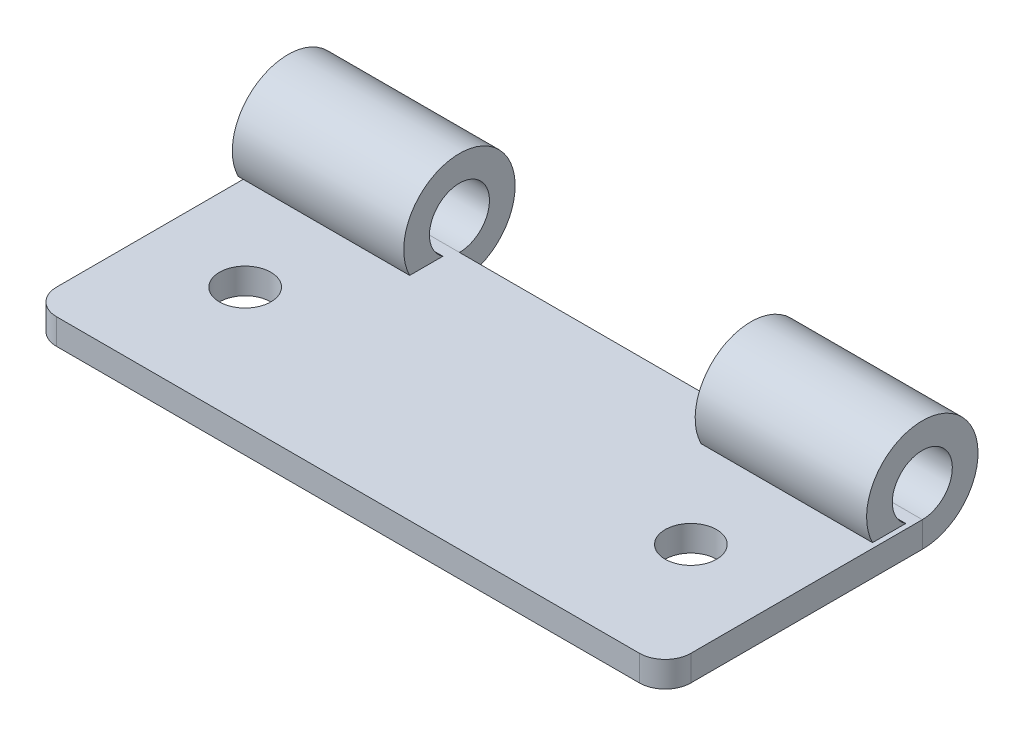
from build123d import *

# Parameters (mm, degrees)
SKETCH_1_W               = 37
SKETCH_1_H               = 15
SKETCH_1_R               = 1.5
SM_BASE_FLANGE_1_DEPTH   = 1.5
SM_BASE_FLANGE_2_DEPTH   = 37
CUT_EXTRUDE_2_DEPTH      = 10
CUT_EXTRUDE_2_DEPTH_BACK = 10
SKETCH_9_W               = 17
SKETCH_9_H               = 10.169597845
SKETCH_16_W              = 17
SKETCH_16_H              = 8.366120423
CUT_EXTRUDE_3_DEPTH      = 10
FILLET_2_R               = 1.5


# Sheet-metal steps are written as plain solids
with BuildPart() as part:
    # Sketch 1 → 基体-法兰1 (new body)
    with BuildSketch(Plane(origin=(0, 0, 0), x_dir=(1, 0, 0), z_dir=(0, 1, 0))):
        with Locations((18.5, 7.5)):
            Rectangle(SKETCH_1_W, SKETCH_1_H)
        with Locations(Location((5.5, 7, 0), (0, 0, 270))):
            Circle(SKETCH_1_R, mode=Mode.SUBTRACT)
        with Locations(Location((31.5, 7, 0), (0, 0, 270))):
            Circle(SKETCH_1_R, mode=Mode.SUBTRACT)
    extrude(amount=-SM_BASE_FLANGE_1_DEPTH)

    # 圆角2
    fillet_2_edges = [part.edges().sort_by_distance(p)[0] for p in [
        (37, -0.75, 0),
        (0, -0.75, 0),
    ]]
    fillet(fillet_2_edges, radius=FILLET_2_R)


with BuildPart() as body_2:
    # 草图6 → 基体-法兰2 (new body)
    with BuildSketch(Plane(origin=(37, 0, 0), x_dir=(0, 0, -1), z_dir=(1, 0, 0))):
        with BuildLine():
            Line((15, 0), (15, -1.5))
            ThreePointArc((15, -1.5), (16.705423269, 4.516592032), (12.09648589, 0.289826786))
            Line((12.09648589, 0.289826786), (14.03543057, 0.289826786))
            ThreePointArc((14.03543057, 0.289826786), (13.324022207, 2.253585582), (15, 3.5))
            ThreePointArc((15, 3.5), (16.75, 1.75), (15, 0))
        make_face()
    extrude(amount=-SM_BASE_FLANGE_2_DEPTH)

    # 草图9 → 切除-拉伸2 (cut, two sides: drawn at the far end of the back side and taken through both)
    with BuildSketch(Plane(origin=(0, 0, 0), x_dir=(1, 0, 0), z_dir=(0, 1, 0)).offset(-CUT_EXTRUDE_2_DEPTH_BACK)):
        with Locations((18.5, 20.084798923)):
            Rectangle(SKETCH_9_W, SKETCH_9_H)
    extrude(amount=CUT_EXTRUDE_2_DEPTH + CUT_EXTRUDE_2_DEPTH_BACK, mode=Mode.SUBTRACT)

    # 草图16 → 切除-拉伸3 (cut)
    with BuildSketch(Plane(origin=(0, 0, -15), x_dir=(-1, 0, 0), z_dir=(0, 0, -1))):
        with Locations((-18.5, 4.183060211)):
            Rectangle(SKETCH_16_W, SKETCH_16_H)
    extrude(amount=-CUT_EXTRUDE_3_DEPTH, mode=Mode.SUBTRACT)


with BuildPart() as cut_extrude_3_piece_1:
    # of the separate pieces the step leaves, piece 1, a body of its own (cut_extrude_3_pieces)
    add(body_2.part.solids().sort_by_distance((37, 0, -15))[0])


with BuildPart() as cut_extrude_3_piece_2:
    # of the separate pieces the step leaves, piece 2, a body of its own (cut_extrude_3_pieces)
    add(body_2.part.solids().sort_by_distance((10, 0, -15))[0])


solid = Compound([part.part, cut_extrude_3_piece_1.part, cut_extrude_3_piece_2.part])
